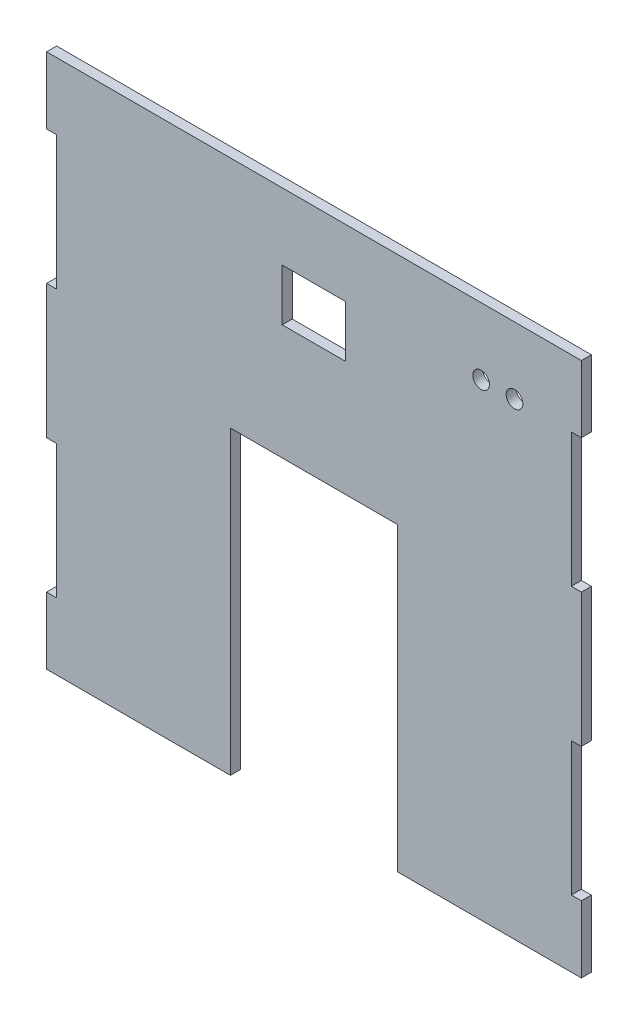
from build123d import *

# Parameters (mm, degrees)
SKETCH1_W           = 19
SKETCH1_H           = 15.5
SKETCH1_R           = 2.5
BOSS_EXTRUDE1_DEPTH = 3
SKETCH2_W           = 3
SKETCH2_H           = 40
CUT_EXTRUDE1_DEPTH  = 114.176852757


with BuildPart() as part:
    # Sketch1 → Boss-Extrude1 (new body)
    with BuildSketch(Plane.XY):
        Polygon((80, 80), (-80, 80), (-80, -80), (-25, -80), (-25, 10), (25, 10), (25, -80), (80, -80), align=None)
        with Locations((0, 52.25)):
            Rectangle(SKETCH1_W, SKETCH1_H, mode=Mode.SUBTRACT)
        with Locations((50, 60)):
            Circle(SKETCH1_R, mode=Mode.SUBTRACT)
        with Locations((60, 60)):
            Circle(SKETCH1_R, mode=Mode.SUBTRACT)
    extrude(amount=BOSS_EXTRUDE1_DEPTH)

    # Sketch2 → Cut-Extrude1 (cut, through all)
    with BuildSketch(Plane.XY.offset(3)):
        with Locations((-78.5, -40)):
            Rectangle(SKETCH2_W, SKETCH2_H)
        with Locations((-78.5, 40)):
            Rectangle(SKETCH2_W, SKETCH2_H)
        with Locations((78.5, 40)):
            Rectangle(SKETCH2_W, SKETCH2_H)
        with Locations((78.5, -40)):
            Rectangle(SKETCH2_W, SKETCH2_H)
    extrude(amount=-CUT_EXTRUDE1_DEPTH, mode=Mode.SUBTRACT)


solid = part.part
